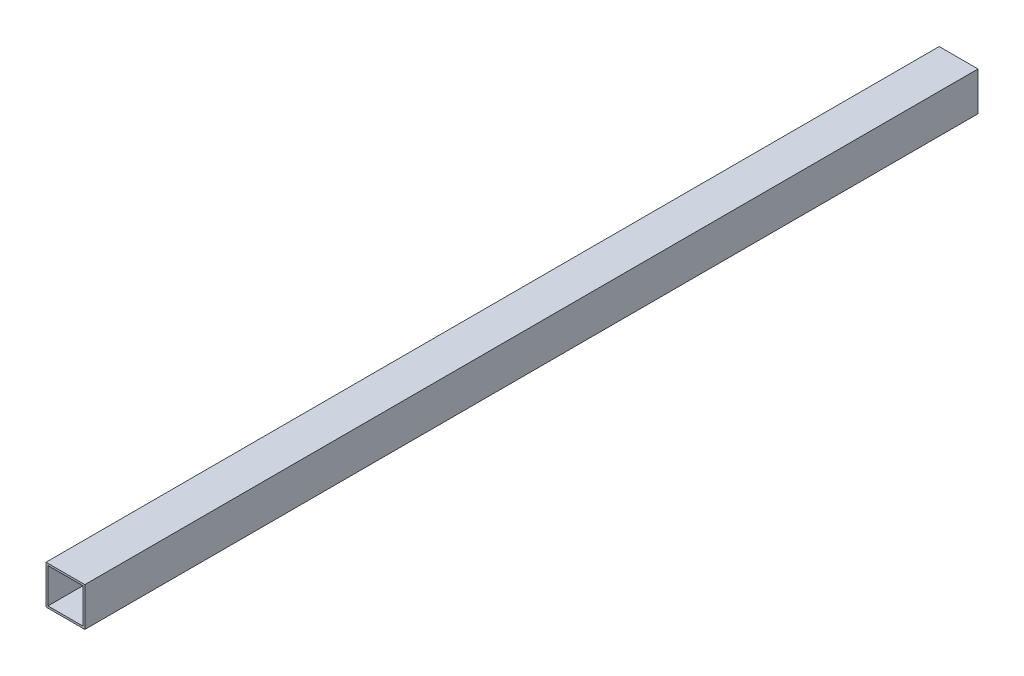
from build123d import *

# Parameters (mm, degrees)
SKETCH_1_W      = 20
SKETCH_1_H      = 20
SKETCH_1_W_2    = 18
SKETCH_1_H_2    = 18
EXTRUDE_1_DEPTH = 460


with BuildPart() as part:
    # 草图1 → 凸台-拉伸1 (new body)
    with BuildSketch(Plane.XY):
        Rectangle(SKETCH_1_W, SKETCH_1_H)
        Rectangle(SKETCH_1_W_2, SKETCH_1_H_2, mode=Mode.SUBTRACT)
    extrude(amount=EXTRUDE_1_DEPTH)


solid = part.part
